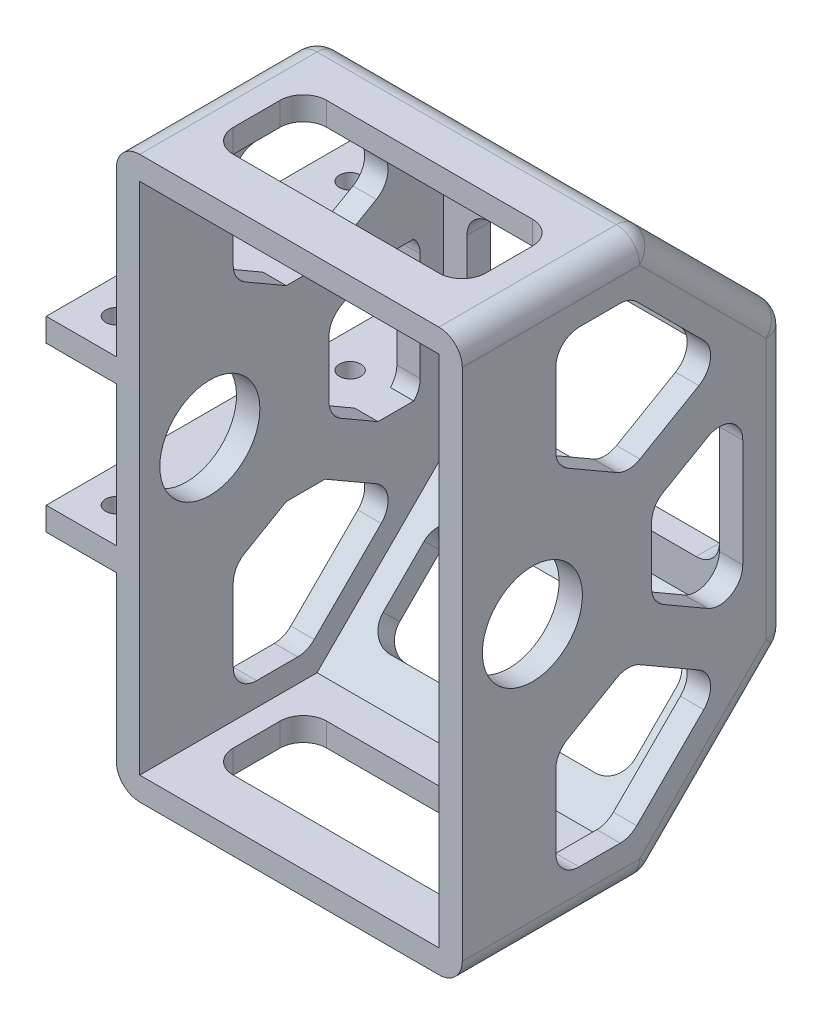
from build123d import *

# Parameters (mm, degrees)
SKETCH_1_W           = 74
SKETCH_1_H           = 120
EXTRUDE_1_DEPTH      = 70
CHAMFER_2_SIZE       = 30
SHELL_1_T            = -5
SKETCH_2_R           = 10.5
CUT_EXTRUDE_1_DEPTH  = 119.220133649
SKETCH_3_W           = 54
SKETCH_3_H           = 22.426406871
CUT_EXTRUDE_2_DEPTH  = 70
SKETCH_4_W           = 54
SKETCH_4_H           = 22.426406871
CUT_EXTRUDE_3_DEPTH  = 70
SKETCH_5_W           = 54
SKETCH_5_H           = 40
CUT_EXTRUDE_4_DEPTH  = 70
SKETCH_7_W           = 54
SKETCH_7_H           = 20
CUT_EXTRUDE_5_DEPTH  = 144.767172887
FILLET_1_R           = 5
EXTRUDE_3_DEPTH      = 15
EXTRUDE_3_DEPTH_BACK = 5
SKETCH_10_W          = 70
SKETCH_10_H          = 5
SKETCH_12_R          = 2.3
CUT_EXTRUDE_7_DEPTH  = 119.33849754
SKETCH_13_R          = 10.7
CUT_EXTRUDE_8_DEPTH  = 119.220133649


with BuildPart() as part:
    # ｽｹｯﾁ1 → ﾎﾞｽ - 押し出し1 (new body)
    with BuildSketch(Plane.XY):
        Rectangle(SKETCH_1_W, SKETCH_1_H)
    extrude(amount=EXTRUDE_1_DEPTH)

    # 面取り2
    chamfer_2_edges = [part.edges().sort_by_distance(p)[0] for p in [
        (0, 60, 0),
        (0, -60, 0),
    ]]
    chamfer(chamfer_2_edges, length=CHAMFER_2_SIZE)

    # ｼｪﾙ1
    shell_1_openings = [part.faces().sort_by_distance(p)[0] for p in [
        (0, 0, 70),
    ]]
    offset(amount=SHELL_1_T, openings=shell_1_openings, kind=Kind.INTERSECTION)

    # ｽｹｯﾁ2 → ｶｯﾄ - 押し出し1 (cut, through all)
    with BuildSketch(Plane.ZY.offset(37)):
        Polygon((34.142135624, -50), (50, -50), (50, -26.558112383), (34.5, -17.60918321), (13.738168081, -29.596032457), align=None)
        with Locations((55, 0)):
            Circle(SKETCH_2_R)
        Polygon((34.142135624, 50), (13.738168081, 29.596032457), (34.5, 17.60918321), (50, 26.558112383), (50, 50), align=None)
        Polygon((10, 20.207259422), (10, -20.207259422), (29.5, -8.948929172), (29.5, 8.948929172), align=None)
    extrude(amount=-CUT_EXTRUDE_1_DEPTH, mode=Mode.SUBTRACT)

    # ｽｹｯﾁ3 → ｶｯﾄ - 押し出し2 (cut)
    with BuildSketch(Plane(origin=(0, -15, -15), x_dir=(1, 0, 0), z_dir=(0, -0.7071067811865464, -0.7071067811865487))):
        with Locations((0, 42.426406872)):
            Rectangle(SKETCH_3_W, SKETCH_3_H)
    extrude(amount=-CUT_EXTRUDE_2_DEPTH, mode=Mode.SUBTRACT)

    # ｽｹｯﾁ4 → ｶｯﾄ - 押し出し3 (cut)
    with BuildSketch(Plane(origin=(0, 15, -15), x_dir=(1, 0, 0), z_dir=(0, 0.7071067811865464, -0.7071067811865487))):
        with Locations((0, -42.426406872)):
            Rectangle(SKETCH_4_W, SKETCH_4_H)
    extrude(amount=-CUT_EXTRUDE_3_DEPTH, mode=Mode.SUBTRACT)

    # ｽｹｯﾁ5 → ｶｯﾄ - 押し出し4 (cut)
    with BuildSketch(Plane(origin=(0, 0, 0), x_dir=(-1, 0, 0), z_dir=(0, 0, -1))):
        Rectangle(SKETCH_5_W, SKETCH_5_H)
    extrude(amount=-CUT_EXTRUDE_4_DEPTH, mode=Mode.SUBTRACT)

    # ｽｹｯﾁ7 → ｶｯﾄ - 押し出し5 (cut, through all)
    with BuildSketch(Plane(origin=(0, 60, 0), x_dir=(1, 0, 0), z_dir=(0, 1, 0))):
        with Locations((0, -50)):
            Rectangle(SKETCH_7_W, SKETCH_7_H)
    extrude(amount=-CUT_EXTRUDE_5_DEPTH, mode=Mode.SUBTRACT)

    # ﾌｨﾚｯﾄ1
    fillet_1_edges = [part.edges().sort_by_distance(p)[0] for p in [
        (27, 51.161165235, 24.696699141),
        (-27, 51.161165235, 24.696699141),
        (-27, 35.303300859, 8.838834765),
        (27, 35.303300859, 8.838834765),
        (-27, 20, 2.5),
        (-27, -20, 2.5),
        (27, 20, 2.5),
        (27, -20, 2.5),
        (-27, -35.303300859, 8.838834765),
        (-27, -51.161165235, 24.696699141),
        (27, -51.161165235, 24.696699141),
        (27, -35.303300859, 8.838834765),
        (34.5, -50, 34.142135624),
        (34.5, -29.596032457, 13.738168081),
        (34.5, -17.60918321, 34.5),
        (34.5, -26.558112383, 50),
        (34.5, -50, 50),
        (34.5, 26.558112383, 50),
        (34.5, 17.60918321, 34.5),
        (34.5, 29.596032457, 13.738168081),
        (34.5, 50, 34.142135624),
        (34.5, 50, 50),
        (34.5, -20.207259422, 10),
        (34.5, -8.948929172, 29.5),
        (34.5, 8.948929172, 29.5),
        (34.5, 20.207259422, 10),
        (-34.5, 29.596032457, 13.738168081),
        (-34.5, 50, 34.142135624),
        (-34.5, 50, 50),
        (-34.5, 26.558112383, 50),
        (-34.5, 17.60918321, 34.5),
        (-34.5, 20.207259422, 10),
        (-34.5, 8.948929172, 29.5),
        (-34.5, -20.207259422, 10),
        (-34.5, -8.948929172, 29.5),
        (-34.5, -29.596032457, 13.738168081),
        (-34.5, -17.60918321, 34.5),
        (-34.5, -26.558112383, 50),
        (-34.5, -50, 50),
        (-34.5, -50, 34.142135624),
        (-27, -57.5, 60),
        (-27, -57.5, 40),
        (27, -57.5, 40),
        (27, -57.5, 60),
        (27, 57.5, 60),
        (27, 57.5, 40),
        (-27, 57.5, 40),
        (-27, 57.5, 60),
        (37, -45, 15),
        (37, -60, 50),
        (-37, -60, 50),
        (-37, -45, 15),
        (0, -30, 0),
        (-37, 0, 0),
        (-37, 45, 15),
        (0, 60, 30),
        (-37, 60, 50),
        (37, 60, 50),
        (0, 30, 0),
        (37, 45, 15),
        (37, 0, 0),
        (0, -60, 30),
    ]]
    fillet(fillet_1_edges, radius=FILLET_1_R)

    # ｽｹｯﾁ10 → ﾎﾞｽ - 押し出し3 (add, two sides: drawn at the far end of the back side and taken through both)
    with BuildSketch(Plane.ZY.offset(37).offset(-EXTRUDE_3_DEPTH_BACK)):
        with Locations((35, 17.5)):
            Rectangle(SKETCH_10_W, SKETCH_10_H)
        with Locations((35, -17.5)):
            Rectangle(SKETCH_10_W, SKETCH_10_H)
    extrude(amount=EXTRUDE_3_DEPTH + EXTRUDE_3_DEPTH_BACK)

    # ｽｹｯﾁ12 → ｶｯﾄ - 押し出し7 (cut, through all)
    with BuildSketch(Plane.XZ.offset(20)):
        with Locations((-44.5, 62.5)):
            Circle(SKETCH_12_R)
        with Locations((-44.5, 12.5)):
            Circle(SKETCH_12_R)
    extrude(amount=-CUT_EXTRUDE_7_DEPTH, mode=Mode.SUBTRACT)

    # ｽｹｯﾁ13 → ｶｯﾄ - 押し出し8 (cut, through all)
    with BuildSketch(Plane.ZY.offset(37)):
        with Locations((55, 0)):
            Circle(SKETCH_13_R)
    extrude(amount=-CUT_EXTRUDE_8_DEPTH, mode=Mode.SUBTRACT)


solid = part.part
